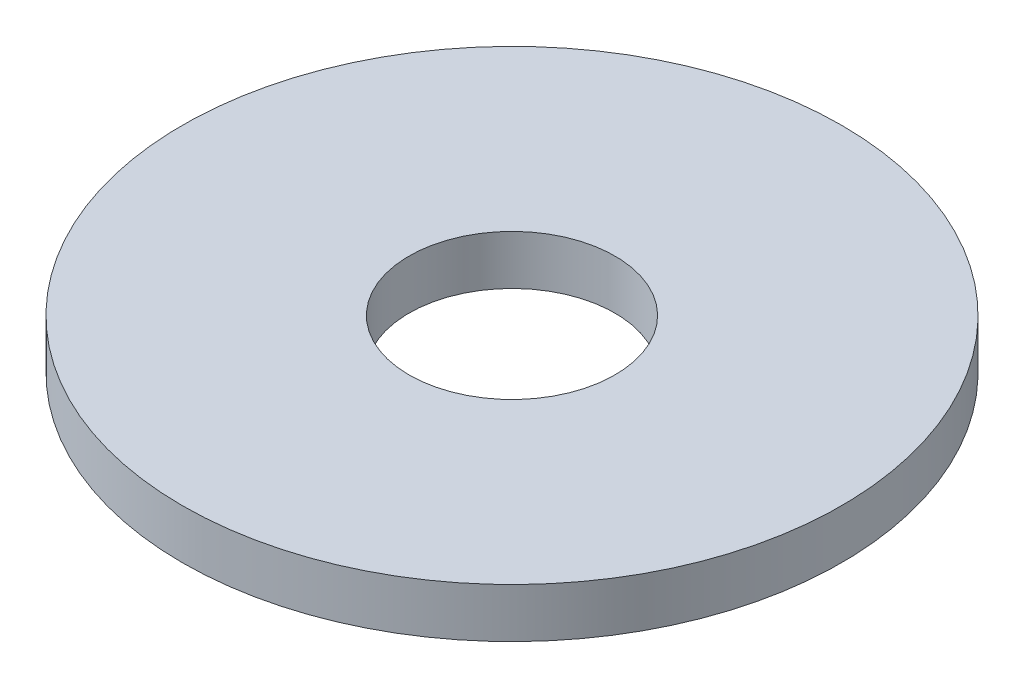
from build123d import *

# Parameters (mm, degrees)
SKETCH1_R           = 20
SKETCH1_R_2         = 6.25
BOSS_EXTRUDE1_DEPTH = 1.5


with BuildPart() as part:
    # Sketch1 → Boss-Extrude1 (new, symmetric)
    with BuildSketch(Plane(origin=(0, 0, 0), x_dir=(1, 0, 0), z_dir=(0, 1, 0))):
        Circle(SKETCH1_R)
        Circle(SKETCH1_R_2, mode=Mode.SUBTRACT)
    extrude(amount=BOSS_EXTRUDE1_DEPTH, both=True)


solid = part.part
